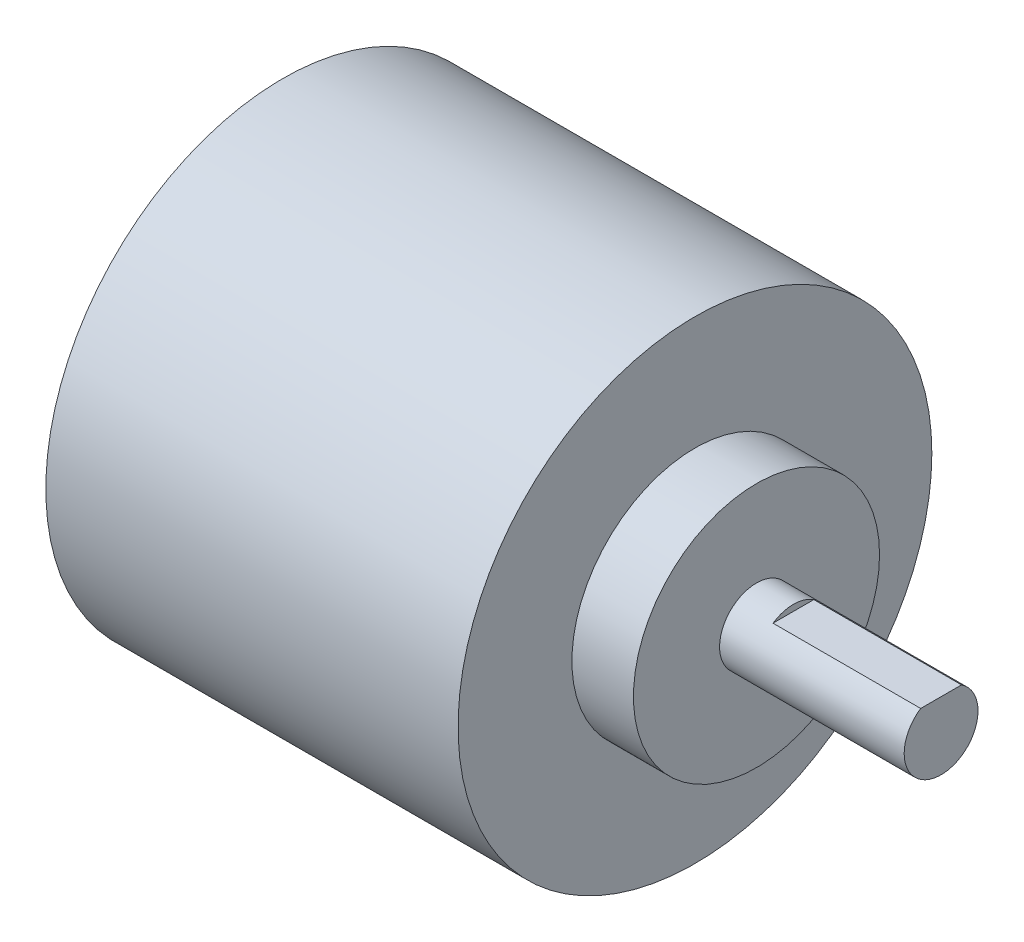
from build123d import *

# Parameters (mm, degrees)
ESQUISSE_BASE_CODEUR_R    = 19.25
BASE_CODEUR_DEPTH         = 33.5
ESQUISSE_PLATEAU_CODEUR_R = 10
PLATEAU_CODEUR_DEPTH      = 5
ESQUISSE_ARBRE_R          = 3
ARBRE_DEPTH               = 15
USINAGE_ARBRE_START       = -12
USINAGE_ARBRE_DEPTH       = 12


with BuildPart() as part:
    # esquisse_base_codeur → base_codeur (new body)
    with BuildSketch(Plane(origin=(0, 0, 0), x_dir=(0, 0, -1), z_dir=(1, 0, 0))):
        Circle(ESQUISSE_BASE_CODEUR_R)
    extrude(amount=BASE_CODEUR_DEPTH)

    # esquisse_plateau_codeur → plateau_codeur (add)
    with BuildSketch(Plane(origin=(33.5, 0, 0), x_dir=(0, 0, -1), z_dir=(1, 0, 0))):
        Circle(ESQUISSE_PLATEAU_CODEUR_R)
    extrude(amount=PLATEAU_CODEUR_DEPTH)

    # esquisse_arbre → arbre (add)
    with BuildSketch(Plane(origin=(38.5, 0, 0), x_dir=(0, 0, -1), z_dir=(1, 0, 0))):
        Circle(ESQUISSE_ARBRE_R)
    extrude(amount=ARBRE_DEPTH)

    # esquisse_usinage_arbre → usinage_arbre (cut)
    with BuildSketch(Plane(origin=(53.5, 0, 0), x_dir=(0, 0, -1), z_dir=(1, 0, 0)).offset(USINAGE_ARBRE_START)):
        with BuildLine():
            Line((-1.658312395, 2.5), (1.658312395, 2.5))
            ThreePointArc((1.658312395, 2.5), (0, 3), (-1.658312395, 2.5))
        make_face()
    extrude(amount=USINAGE_ARBRE_DEPTH, mode=Mode.SUBTRACT)


solid = part.part
